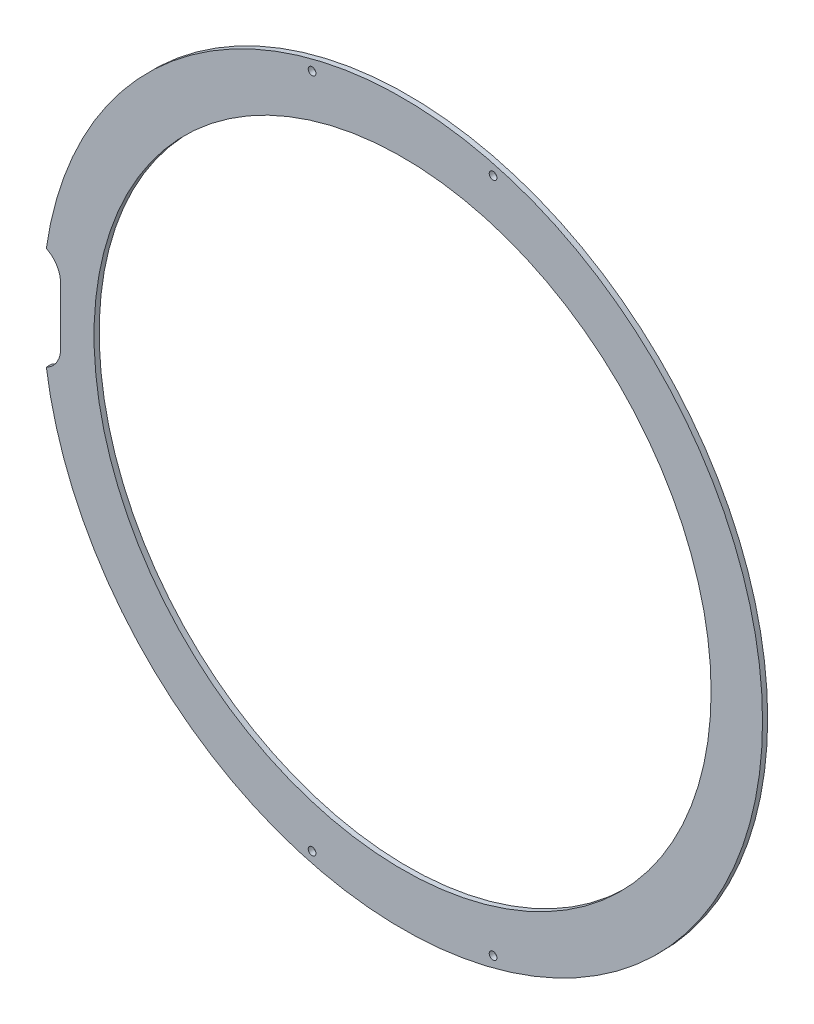
from build123d import *

# Parameters (mm, degrees)
ESQUISSE1_R             = 140
ESQUISSE1_R_2           = 120
BOSS_EXTRU_1_DEPTH      = 2
ENL_V_MAT_EXTRU_1_REACH = 200
ESQUISSE2_W             = 10
ESQUISSE2_H             = 40
ESQUISSE4_W             = 11.636908411
ESQUISSE4_H             = 60
BOSS_EXTRU_2_DEPTH      = 2
CONG_1_R                = 10
ENL_V_MAT_EXTRU_2_REACH = 200
ESQUISSE5_R             = 1.5


with BuildPart() as part:
    # Esquisse1 → Boss.-Extru.1 (new body)
    with BuildSketch(Plane.XY):
        Circle(ESQUISSE1_R)
        Circle(ESQUISSE1_R_2, mode=Mode.SUBTRACT)
    extrude(amount=BOSS_EXTRU_1_DEPTH)

    # Esquisse2 → Enlèv. mat.-Extru.1 (cut, up to next)
    with BuildSketch(Plane.XY.offset(2), mode=Mode.PRIVATE) as enl_v_mat_extru_1_sk1:
        with Locations((-138, 0)):
            Rectangle(ESQUISSE2_W, ESQUISSE2_H)
    enl_v_mat_extru_1_tool1 = extrude(enl_v_mat_extru_1_sk1.sketch, amount=-ENL_V_MAT_EXTRU_1_REACH, mode=Mode.PRIVATE) & part.part
    add(enl_v_mat_extru_1_tool1.solids().sort_by_distance((-138, 0, 2))[0], mode=Mode.SUBTRACT)

    # Esquisse4 → Boss.-Extru.2 (add)
    with BuildSketch(Plane.XY.offset(2)):
        with Locations((-127.181545795, 10)):
            Rectangle(ESQUISSE4_W, ESQUISSE4_H)
    extrude(amount=-BOSS_EXTRU_2_DEPTH)

    # Congé1
    # the kernel refuses this fillet: 10 mm, written as the material it adds along each edge
    with BuildSketch(Plane(origin=(-133, -20, 2), x_dir=(-1, 0, 0), z_dir=(0, 0, -1))) as cong_1_piece_1:
        with BuildLine():
            CenterArc((10, 8.962280802), CONG_1_R, 180, 63.666611113)
            Line((0, 8.962280802), (-0.2, 8.962280802))
            Line((-0.2, 8.962280802), (-0.2, 0))
            Line((-0.2, 0), (0, -0.2))
            ThreePointArc((0, -0.2), (2.782032303, -0.2), (5.475345898, -0.179245616))
            Line((5.475345898, -0.179245616), (5.564064606, 0))
        make_face()
    extrude(amount=2)
    with BuildSketch(Plane(origin=(-133, 20, 2), x_dir=(-1, 0, 0), z_dir=(0, 0, -1))) as cong_1_piece_2:
        with BuildLine():
            CenterArc((10, -8.962280802), CONG_1_R, 116.333388887, 63.666611113)
            Line((0, -8.962280802), (-0.2, -8.962280802))
            Line((-0.2, -8.962280802), (-0.2, 0))
            Line((-0.2, 0), (0, 0.2))
            ThreePointArc((0, 0.2), (2.782032303, 0.2), (5.475345898, 0.179245616))
            Line((5.475345898, 0.179245616), (5.564064606, 0))
        make_face()
    extrude(amount=2)

    # Esquisse5 → Enlèv. mat.-Extru.2 (cut, up to next)
    with BuildSketch(Plane.XY.offset(2), mode=Mode.PRIVATE) as enl_v_mat_extru_2_sk1:
        with Locations((-35.199390134, -131.365912375)):
            Circle(ESQUISSE5_R)
    enl_v_mat_extru_2_tool1 = extrude(enl_v_mat_extru_2_sk1.sketch, amount=-ENL_V_MAT_EXTRU_2_REACH, mode=Mode.PRIVATE) & part.part
    # Esquisse5 → Enlèv. mat.-Extru.2 (cut, up to next)
    with BuildSketch(Plane.XY.offset(2), mode=Mode.PRIVATE) as enl_v_mat_extru_2_sk2:
        with Locations((35.199390134, -131.365912375)):
            Circle(ESQUISSE5_R)
    enl_v_mat_extru_2_tool2 = extrude(enl_v_mat_extru_2_sk2.sketch, amount=-ENL_V_MAT_EXTRU_2_REACH, mode=Mode.PRIVATE) & part.part
    # Esquisse5 → Enlèv. mat.-Extru.2 (cut, up to next)
    with BuildSketch(Plane.XY.offset(2), mode=Mode.PRIVATE) as enl_v_mat_extru_2_sk3:
        with Locations((-35.199390134, 131.365912375)):
            Circle(ESQUISSE5_R)
    enl_v_mat_extru_2_tool3 = extrude(enl_v_mat_extru_2_sk3.sketch, amount=-ENL_V_MAT_EXTRU_2_REACH, mode=Mode.PRIVATE) & part.part
    # Esquisse5 → Enlèv. mat.-Extru.2 (cut, up to next)
    with BuildSketch(Plane.XY.offset(2), mode=Mode.PRIVATE) as enl_v_mat_extru_2_sk4:
        with Locations((35.199390134, 131.365912375)):
            Circle(ESQUISSE5_R)
    enl_v_mat_extru_2_tool4 = extrude(enl_v_mat_extru_2_sk4.sketch, amount=-ENL_V_MAT_EXTRU_2_REACH, mode=Mode.PRIVATE) & part.part
    add(enl_v_mat_extru_2_tool1.solids().sort_by_distance((-35.19939, -131.365912, 2))[0], mode=Mode.SUBTRACT)
    add(enl_v_mat_extru_2_tool2.solids().sort_by_distance((35.19939, -131.365912, 2))[0], mode=Mode.SUBTRACT)
    add(enl_v_mat_extru_2_tool3.solids().sort_by_distance((-35.19939, 131.365912, 2))[0], mode=Mode.SUBTRACT)
    add(enl_v_mat_extru_2_tool4.solids().sort_by_distance((35.19939, 131.365912, 2))[0], mode=Mode.SUBTRACT)


solid = part.part
